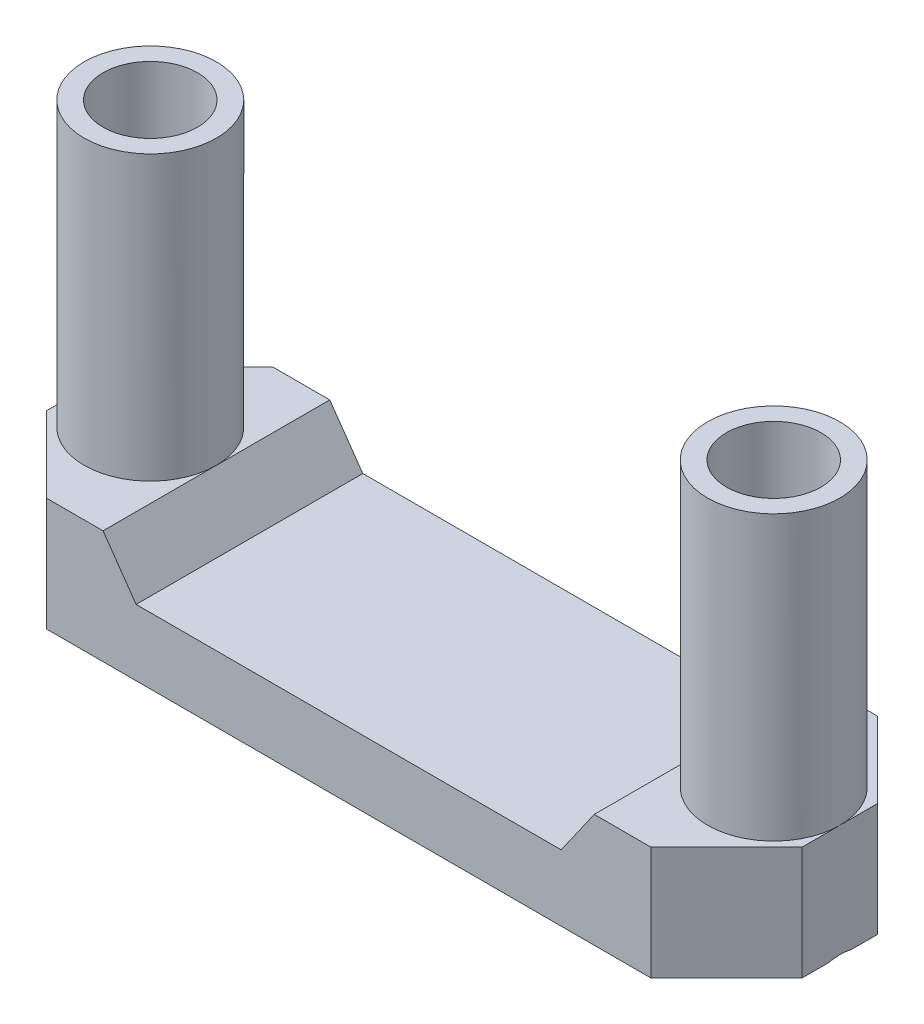
from build123d import *
from OCP.BRepFilletAPI import BRepFilletAPI_MakeChamfer

# Parameters (mm, degrees)
SKETCH1_W           = 20
SKETCH1_H           = 6
SKETCH1_R           = 1.25
BOSS_EXTRUDE1_DEPTH = 3
SKETCH2_W           = 13
SKETCH2_H           = 6
CUT_EXTRUDE1_DEPTH  = 1.25
CHAMFER1_SIZE       = 2
SKETCH3_R           = 1.75
SKETCH3_R_2         = 1.25
BOSS_EXTRUDE2_DEPTH = 7.5
CHAMFER2_SIZE       = 0.525155654
CHAMFER2_SIZE_2     = 0.75
CHAMFER3_SIZE       = 1.25
CHAMFER3_SIZE_2     = 0.875259423


# Some blends are built 0.0001 mm under size
with BuildPart() as part:
    # Sketch1 → Boss-Extrude1 (new body)
    with BuildSketch(Plane(origin=(0, 0, 0), x_dir=(1, 0, 0), z_dir=(0, 1, 0))):
        Rectangle(SKETCH1_W, SKETCH1_H)
        with Locations(Location((-8.25, 0, 0), (0, 0, 270))):
            Circle(SKETCH1_R, mode=Mode.SUBTRACT)
        with Locations(Location((8.25, 0, 0), (0, 0, 90))):
            Circle(SKETCH1_R, mode=Mode.SUBTRACT)
    extrude(amount=BOSS_EXTRUDE1_DEPTH)

    # Sketch2 → Cut-Extrude1 (cut)
    with BuildSketch(Plane(origin=(0, 3, 0), x_dir=(1, 0, 0), z_dir=(0, 1, 0))):
        Rectangle(SKETCH2_W, SKETCH2_H)
    extrude(amount=-CUT_EXTRUDE1_DEPTH, mode=Mode.SUBTRACT)

    # Chamfer1
    chamfer1_edges = [part.edges().sort_by_distance(p)[0] for p in [
        (10, 1.5, 3),
        (-10, 1.5, 3),
        (-10, 1.5, -3),
        (10, 1.5, -3),
    ]]
    chamfer(chamfer1_edges, length=CHAMFER1_SIZE)

    # Sketch3 → Boss-Extrude2 (add)
    with BuildSketch(Plane(origin=(0, 3, 0), x_dir=(1, 0, 0), z_dir=(0, 1, 0))):
        with Locations(Location((-8.25, 0, 0), (0, 0, 180))):
            Circle(SKETCH3_R)
        with Locations(Location((-8.25, 0, 0), (0, 0, 270))):
            Circle(SKETCH3_R_2, mode=Mode.SUBTRACT)
    boss_extrude2 = extrude(amount=BOSS_EXTRUDE2_DEPTH)

    # Mirror1: Boss-Extrude2 across plane
    add(boss_extrude2.mirror(Plane(origin=(0, 0, 0), x_dir=(0, 0, 1), z_dir=(1, 0, 0))))

    # Chamfer2
    # the kernel refuses this chamfer: 0.75, 0.525155654 mm, written as the material it takes off along each edge
    with BuildSketch(Plane(origin=(-8.25, 0, 0), x_dir=(0, 0, 1), z_dir=(-1, 0, 0))) as chamfer2_piece_1:
        Polygon((1.25 + CHAMFER2_SIZE, 0), (1.25, CHAMFER2_SIZE_2), (1.25, 0), align=None)
    revolve(axis=Axis((-8.25, 0, 0), (0, 1, 0)), mode=Mode.SUBTRACT)
    with BuildSketch(Plane(origin=(8.25, 0, 0), x_dir=(0, 0, -1), z_dir=(1, 0, 0))) as chamfer2_piece_2:
        Polygon((1.25 + CHAMFER2_SIZE, 0), (1.25, CHAMFER2_SIZE_2), (1.25, 0), align=None)
    revolve(axis=Axis((8.25, 0, 0), (0, 1, 0)), mode=Mode.SUBTRACT)

    # Chamfer3
    chamfer3_edges_1 = [part.edges().sort_by_distance(p)[0] for p in [
        (6.5, 1.75, 0),
    ]]
    chamfer3_side_1 = [part.faces().sort_by_distance(p)[0] for p in [
        (6.5, 1.767505188, 0),
    ]]
    chamfer3_edges_2 = [part.edges().sort_by_distance(p)[0] for p in [
        (-6.5, 1.75, 0),
    ]]
    chamfer3_side_2 = [part.faces().sort_by_distance(p)[0] for p in [
        (-6.5, 1.767505188, 0),
    ]]
    chamfer3 = BRepFilletAPI_MakeChamfer(part.part.solid().wrapped)
    for e in chamfer3_edges_1:
        chamfer3.Add(CHAMFER3_SIZE - 0.0001, CHAMFER3_SIZE_2 - 0.0001, e.wrapped, chamfer3_side_1[0].wrapped)
    for e in chamfer3_edges_2:
        chamfer3.Add(CHAMFER3_SIZE - 0.0001, CHAMFER3_SIZE_2 - 0.0001, e.wrapped, chamfer3_side_2[0].wrapped)
    add(Compound.cast(chamfer3.Shape()), mode=Mode.REPLACE)  # a hair under: the kernel refuses the full size


solid = part.part
